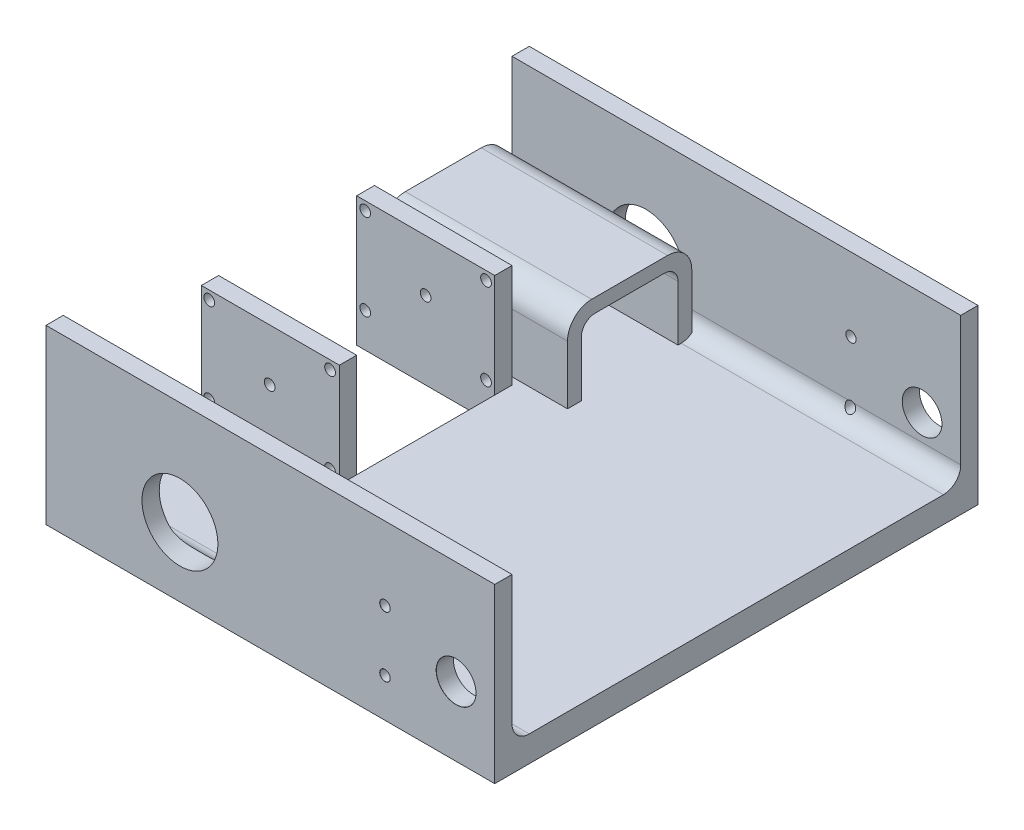
from build123d import *

# Parameters (mm, degrees)
BOSS_EXTRUDE1_DEPTH                    = 7.5
SKETCH2_4_W                            = 130
SKETCH2_4_H                            = 5
BOSS_EXTRUDE2_DEPTH                    = 50
F_3_0MM_DOWEL_HOLE1_D                  = 3
F_3_0MM_DOWEL_HOLE1_CSINK_D            = 3.05
F_3_0MM_DOWEL_HOLE1_CSINK_ANGLE        = 90
FILLET1_R                              = 5
F_11_5_11_5_DIAMETER_HOLE2_D           = 11.5
F_11_5_11_5_DIAMETER_HOLE2_CSINK_D     = 11.55
F_11_5_11_5_DIAMETER_HOLE2_CSINK_ANGLE = 90
F_1_0_22_DIAMETER_HOLE1_D              = 22
F_1_0_22_DIAMETER_HOLE1_DEPTH          = 140
F_1_0_22_DIAMETER_HOLE1_TIP            = 6.609466809
SKETCH16_W                             = 40
SKETCH16_H                             = 5
BOSS_EXTRUDE3_DEPTH                    = 30
F_3_1_3_1_DIAMETER_HOLE1_AT_2_COUNT    = 2
F_3_1_3_1_DIAMETER_HOLE1_AT_2_PITCH    = 21.505813168
F_3_1_3_1_DIAMETER_HOLE1_AT_3_COUNT    = 2
F_3_1_3_1_DIAMETER_HOLE1_AT_3_PITCH    = 21.505813168
F_3_1_3_1_DIAMETER_HOLE1_AT_4_COUNT    = 2
F_3_1_3_1_DIAMETER_HOLE1_AT_4_PITCH    = 21.505813168
F_3_1_3_1_DIAMETER_HOLE1_AT_5_COUNT    = 2
F_3_1_3_1_DIAMETER_HOLE1_AT_5_PITCH    = 21.505813168
SKETCH22_W                             = 36
SKETCH22_H                             = 24
BOSS_EXTRUDE4_DEPTH                    = 54
SKETCH23_W                             = 28
SKETCH23_H                             = 20
CUT_EXTRUDE1_DEPTH                     = 50
FILLET2_R                              = 4
FILLET3_R                              = 7


with BuildPart() as part:
    # Sketch2 → Boss-Extrude1 (new body)
    with BuildSketch(Plane(origin=(0, 0, 0), x_dir=(1, 0, 0), z_dir=(0, 1, 0))):
        Polygon((65, 65), (-65, 65), (-65, 25.164265249), (-65, 20), (-25, 20), (-25, -20), (-65, -20), (-65, -25.134268309), (-65, -65), (65, -65), align=None)
    extrude(amount=BOSS_EXTRUDE1_DEPTH)

    # Sketch2<4> → Boss-Extrude2 (add)
    with BuildSketch(Plane(origin=(0, 0, 0), x_dir=(1, 0, 0), z_dir=(0, 1, 0))):
        with Locations((0, -67.5)):
            Rectangle(SKETCH2_4_W, SKETCH2_4_H)
        with Locations((0, 67.5)):
            Rectangle(SKETCH2_4_W, SKETCH2_4_H)
    extrude(amount=BOSS_EXTRUDE2_DEPTH)

    # Ø3.0mm Dowel Hole1 (through all)
    with Locations(Plane.XY.offset(70)):
        with Locations((33.2, 28.75), (33.2, 11.25)):
            CounterSinkHole(F_3_0MM_DOWEL_HOLE1_D / 2, F_3_0MM_DOWEL_HOLE1_CSINK_D / 2, counter_sink_angle=F_3_0MM_DOWEL_HOLE1_CSINK_ANGLE)

    # Fillet1
    # the kernel refuses this fillet: 5 mm, written as the material it adds along each edge
    with BuildSketch(Plane(origin=(-65, 7.5, 65), x_dir=(0, 0, -1), z_dir=(1, 0, 0))) as fillet1_piece_1_section:
        with BuildLine():
            CenterArc((FILLET1_R, FILLET1_R), FILLET1_R, 180, 90)
            Line((0, FILLET1_R), (0, 0))
            Line((0, 0), (FILLET1_R, 0))
        make_face()
    fillet1_piece_1 = extrude(amount=130, mode=Mode.PRIVATE)
    fillet1_piece_1 = fillet1_piece_1 - Plane(origin=(33.2, 11.25, 63.865303448), x_dir=(-1, 0, 0), z_dir=(0, 0, -1)) * Cylinder(1.5, 280, mode=Mode.PRIVATE)
    add(fillet1_piece_1)
    with BuildSketch(Plane(origin=(65, 7.5, -65), x_dir=(0, 0, 1), z_dir=(-1, 0, 0))) as fillet1_piece_2_section:
        with BuildLine():
            CenterArc((FILLET1_R, FILLET1_R), FILLET1_R, 180, 90)
            Line((0, FILLET1_R), (0, 0))
            Line((0, 0), (FILLET1_R, 0))
        make_face()
    fillet1_piece_2 = extrude(amount=130, mode=Mode.PRIVATE)
    fillet1_piece_2 = fillet1_piece_2 - Plane(origin=(33.2, 11.25, -63.865303448), x_dir=(-1, 0, 0), z_dir=(0, 0, -1)) * Cylinder(1.5, 280, mode=Mode.PRIVATE)
    add(fillet1_piece_2)

    # Ø11.5 (11.5) Diameter Hole2 (through all)
    with Locations(Plane(origin=(53.8, 20, 70), x_dir=(1, 0, 0), z_dir=(0, 0, 1))):
        with Locations((0, 0)):
            CounterSinkHole(F_11_5_11_5_DIAMETER_HOLE2_D / 2, F_11_5_11_5_DIAMETER_HOLE2_CSINK_D / 2, counter_sink_angle=F_11_5_11_5_DIAMETER_HOLE2_CSINK_ANGLE)

    # Ø1.0 (22) Diameter Hole1
    with Locations(Plane(origin=(-26.2, 20, 70), x_dir=(1, 0, 0), z_dir=(0, 0, 1))):
        with Locations((0, 0)):
            Hole(F_1_0_22_DIAMETER_HOLE1_D / 2, depth=F_1_0_22_DIAMETER_HOLE1_DEPTH)
            with Locations((0, 0, -(F_1_0_22_DIAMETER_HOLE1_DEPTH + F_1_0_22_DIAMETER_HOLE1_TIP / 2))):  # 118° drill point
                Cone(0, F_1_0_22_DIAMETER_HOLE1_D / 2, F_1_0_22_DIAMETER_HOLE1_TIP, mode=Mode.SUBTRACT)

    # Sketch16 → Boss-Extrude3 (add)
    with BuildSketch(Plane(origin=(0, 7.5, 0), x_dir=(1, 0, 0), z_dir=(0, 1, 0))):
        Polygon((-65, 20), (-65, 25.164265249), (-25, 25), (-25, 20), align=None)
        with Locations((-45, -22.5)):
            Rectangle(SKETCH16_W, SKETCH16_H)
    extrude(amount=BOSS_EXTRUDE3_DEPTH)

    # Sketch20 → Ø3.1 (3.1) Diameter Hole1 (revolve, cut)
    with BuildSketch(Plane(origin=(-45, 22.5, -25.082132625), x_dir=(-0.9999915678966332, 0, -0.004106596599781751), z_dir=(0, 1, 0))):
        Polygon((0, 0), (0, 51.096180316), (1.55, 50.164846357), (1.55, 0.025), (1.575, 0), align=None)
    f_3_1_3_1_diameter_hole1 = revolve(axis=Axis((-44.973923112, 22.5, -31.432079081), (-0.004106596599781799, 0, 0.9999915678966332)), mode=Mode.SUBTRACT)

    # Ø3.1 (3.1) Diameter Hole1 at 2: Ø3.1 (3.1) Diameter Hole1 ×2
    with Locations(*[Vector(0.8137266097219926, 0.5812381937190964, 0.0033416751059861844) * (i * F_3_1_3_1_DIAMETER_HOLE1_AT_2_PITCH) for i in range(1, F_3_1_3_1_DIAMETER_HOLE1_AT_2_COUNT)]):
        add(f_3_1_3_1_diameter_hole1, mode=Mode.SUBTRACT)

    # Ø3.1 (3.1) Diameter Hole1 at 3: Ø3.1 (3.1) Diameter Hole1 ×2
    with Locations(*[Vector(-0.8137266097219932, 0.5812381937190956, -0.0033416751059863045) * (i * F_3_1_3_1_DIAMETER_HOLE1_AT_3_PITCH) for i in range(1, F_3_1_3_1_DIAMETER_HOLE1_AT_3_COUNT)]):
        add(f_3_1_3_1_diameter_hole1, mode=Mode.SUBTRACT)

    # Ø3.1 (3.1) Diameter Hole1 at 4: Ø3.1 (3.1) Diameter Hole1 ×2
    with Locations(*[Vector(-0.8137266097219928, -0.5812381937190962, -0.0033416751059863027) * (i * F_3_1_3_1_DIAMETER_HOLE1_AT_4_PITCH) for i in range(1, F_3_1_3_1_DIAMETER_HOLE1_AT_4_COUNT)]):
        add(f_3_1_3_1_diameter_hole1, mode=Mode.SUBTRACT)

    # Ø3.1 (3.1) Diameter Hole1 at 5: Ø3.1 (3.1) Diameter Hole1 ×2
    with Locations(*[Vector(0.8137266097219922, -0.581238193719097, 0.003341675105986184) * (i * F_3_1_3_1_DIAMETER_HOLE1_AT_5_PITCH) for i in range(1, F_3_1_3_1_DIAMETER_HOLE1_AT_5_COUNT)]):
        add(f_3_1_3_1_diameter_hole1, mode=Mode.SUBTRACT)

    # Sketch22 → Boss-Extrude4 (add)
    with BuildSketch(Plane.ZY.offset(65)):
        with Locations((-45.082132625, 19.5)):
            Rectangle(SKETCH22_W, SKETCH22_H)
    extrude(amount=-BOSS_EXTRUDE4_DEPTH)

    # Sketch23 → Cut-Extrude1 (cut)
    with BuildSketch(Plane(origin=(-11, 0, 0), x_dir=(0, 0, -1), z_dir=(1, 0, 0))):
        with Locations((45.082132625, 17.5)):
            Rectangle(SKETCH23_W, SKETCH23_H)
    extrude(amount=-CUT_EXTRUDE1_DEPTH, mode=Mode.SUBTRACT)

    # Fillet2
    fillet2_edges = [part.edges().sort_by_distance(p)[0] for p in [
        (-36, 27.5, -31.082132625),
        (-36, 27.5, -59.082132625),
    ]]
    fillet(fillet2_edges, radius=FILLET2_R)

    # Fillet3
    fillet3_edges = [part.edges().sort_by_distance(p)[0] for p in [
        (-38, 31.5, -27.082132625),
        (-38, 31.5, -63.082132625),
    ]]
    fillet(fillet3_edges, radius=FILLET3_R)


solid = part.part
